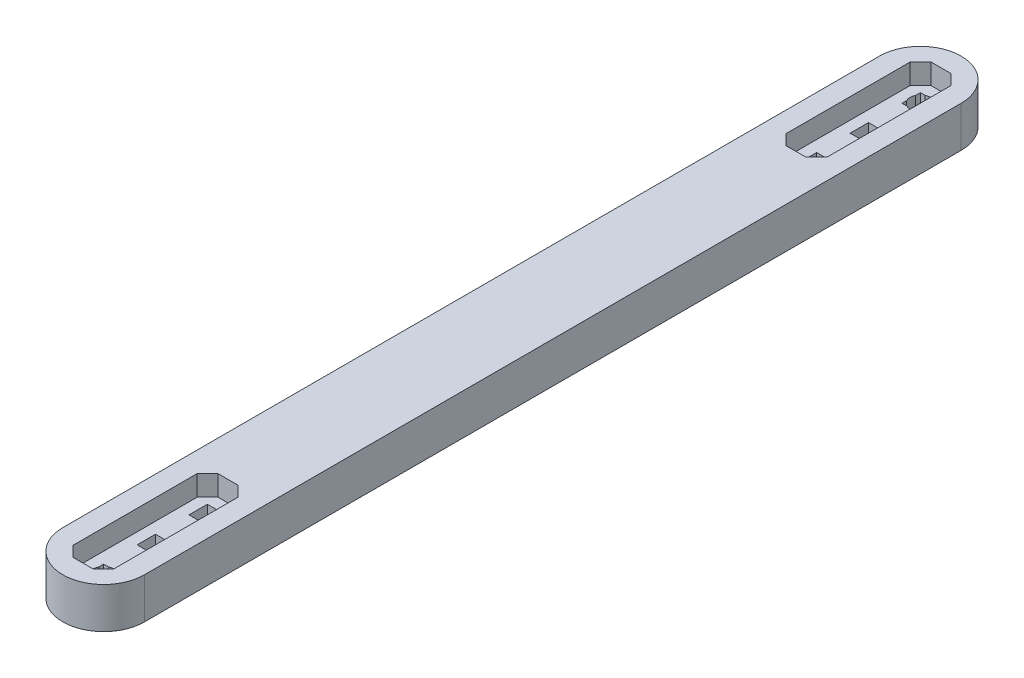
from build123d import *

# Parameters (mm, degrees)
SKETCH1_R           = 2.5
BOSS_EXTRUDE1_DEPTH = 10
CUT_EXTRUDE1_START  = -10
SKETCH2_R           = 2.5
SKETCH2_W           = 4.5
SKETCH2_H           = 4.5
CUT_EXTRUDE1_DEPTH  = 10
CUT_EXTRUDE2_START  = -5
SKETCH2_3_W         = 4.5
SKETCH2_3_H         = 4.5
CUT_EXTRUDE2_DEPTH  = 5


with BuildPart() as part:
    # Sketch1 → Boss-Extrude1 (new body)
    with BuildSketch(Plane(origin=(0, 0, 0), x_dir=(1, 0, 0), z_dir=(0, 1, 0))):
        with BuildLine():
            ThreePointArc((-10, -100), (0, -110), (10, -100))
            Line((10, -100), (10, 100))
            ThreePointArc((10, 100), (0, 110), (-10, 100))
            Line((-10, 100), (-10, -100))
        make_face()
        with Locations((0, -100)):
            Circle(SKETCH1_R, mode=Mode.SUBTRACT)
        with BuildLine():
            ThreePointArc((1.5875, 98.4125), (0, 97.75493597), (-1.5875, 98.4125))
            ThreePointArc((-1.5875, 98.4125), (-2.24506403, 100), (-1.5875, 101.5875))
            ThreePointArc((-1.5875, 101.5875), (0, 102.24506403), (1.5875, 101.5875))
            ThreePointArc((1.5875, 101.5875), (2.074168707, 100.859148809), (2.24506403, 100))
            ThreePointArc((2.24506403, 100), (2.074168707, 99.140851191), (1.5875, 98.4125))
        make_face(mode=Mode.SUBTRACT)
    extrude(amount=BOSS_EXTRUDE1_DEPTH)

    # Sketch2 → Cut-Extrude1 (cut)
    with BuildSketch(Plane(origin=(0, 10, 0), x_dir=(1, 0, 0), z_dir=(0, 1, 0)).offset(CUT_EXTRUDE1_START)):
        with Locations((0, -100)):
            Circle(SKETCH2_R)
        with Locations((0, 100)):
            Circle(SKETCH2_R)
        with Locations((0, -74.6)):
            Rectangle(SKETCH2_W, SKETCH2_H)
        with Locations((0, -87.3)):
            Rectangle(SKETCH2_W, SKETCH2_H)
        with Locations((0, -100)):
            Rectangle(SKETCH2_W, SKETCH2_H)
        with Locations((0, 100)):
            Rectangle(SKETCH2_W, SKETCH2_H)
        with Locations((0, 87.3)):
            Rectangle(SKETCH2_W, SKETCH2_H)
        with Locations((0, 74.6)):
            Rectangle(SKETCH2_W, SKETCH2_H)
    extrude(amount=CUT_EXTRUDE1_DEPTH, mode=Mode.SUBTRACT)

    # Sketch2<3> → Cut-Extrude2 (cut)
    # profile 1 of 2: a face of its own
    with BuildSketch(Plane(origin=(0, 10, 0), x_dir=(1, 0, 0), z_dir=(0, 1, 0)).offset(CUT_EXTRUDE2_START)):
        Polygon((-5, -72.09), (-5, -102.51), (-2.46, -105.05), (2.46, -105.05), (5, -102.51), (5, -72.09), (2.46, -69.55), (-2.46, -69.55), align=None)
        with BuildLine():
            Line((1.089724736, -97.75), (2.25, -97.75))
            Line((2.25, -97.75), (2.25, -98.910275264))
            ThreePointArc((2.25, -98.910275264), (2.5, -100), (2.25, -101.089724736))
            Line((2.25, -101.089724736), (2.25, -102.25))
            Line((2.25, -102.25), (1.089724736, -102.25))
            ThreePointArc((1.089724736, -102.25), (0, -102.5), (-1.089724736, -102.25))
            Line((-1.089724736, -102.25), (-2.25, -102.25))
            Line((-2.25, -102.25), (-2.25, -101.089724736))
            ThreePointArc((-2.25, -101.089724736), (-2.5, -100), (-2.25, -98.910275264))
            Line((-2.25, -98.910275264), (-2.25, -97.75))
            Line((-2.25, -97.75), (-1.089724736, -97.75))
            ThreePointArc((-1.089724736, -97.75), (0, -97.5), (1.089724736, -97.75))
        make_face(mode=Mode.SUBTRACT)
        with Locations((0, -87.3)):
            Rectangle(SKETCH2_3_W, SKETCH2_3_H, mode=Mode.SUBTRACT)
        with Locations((0, -74.6)):
            Rectangle(SKETCH2_3_W, SKETCH2_3_H, mode=Mode.SUBTRACT)
    # profile 2 of 2: a face of its own
    with BuildSketch(Plane(origin=(0, 10, 0), x_dir=(1, 0, 0), z_dir=(0, 1, 0)).offset(CUT_EXTRUDE2_START)):
        Polygon((-5, 102.51), (-5, 72.09), (-2.46, 69.55), (2.46, 69.55), (5, 72.09), (5, 102.51), (2.46, 105.05), (-2.46, 105.05), align=None)
        with Locations((0, 74.6)):
            Rectangle(SKETCH2_3_W, SKETCH2_3_H, mode=Mode.SUBTRACT)
        with Locations((0, 87.3)):
            Rectangle(SKETCH2_3_W, SKETCH2_3_H, mode=Mode.SUBTRACT)
        with BuildLine():
            Line((-1.089724736, 97.75), (-2.25, 97.75))
            Line((-2.25, 97.75), (-2.25, 98.910275264))
            ThreePointArc((-2.25, 98.910275264), (-2.5, 100), (-2.25, 101.089724736))
            Line((-2.25, 101.089724736), (-2.25, 102.25))
            Line((-2.25, 102.25), (-1.089724736, 102.25))
            ThreePointArc((-1.089724736, 102.25), (0, 102.5), (1.089724736, 102.25))
            Line((1.089724736, 102.25), (2.25, 102.25))
            Line((2.25, 102.25), (2.25, 101.089724736))
            ThreePointArc((2.25, 101.089724736), (2.5, 100), (2.25, 98.910275264))
            Line((2.25, 98.910275264), (2.25, 97.75))
            Line((2.25, 97.75), (1.089724736, 97.75))
            ThreePointArc((1.089724736, 97.75), (0, 97.5), (-1.089724736, 97.75))
        make_face(mode=Mode.SUBTRACT)
    extrude(amount=CUT_EXTRUDE2_DEPTH, mode=Mode.SUBTRACT)


solid = part.part
